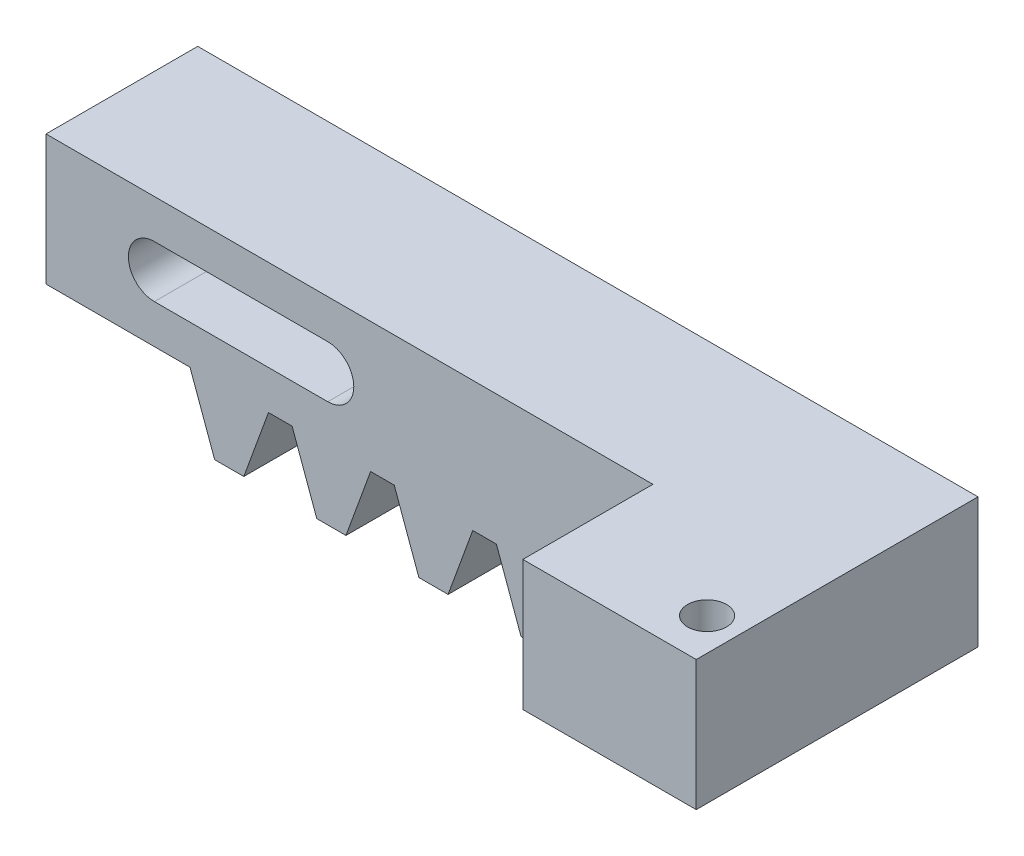
from build123d import *

# Parameters (mm, degrees)
BOSS_EXTRUDE1_START     = 13.5
BOSS_EXTRUDE1_DEPTH     = 7
BOSS_EXTRUDE2_START     = 20.5
SKETCH2_W               = 8
SKETCH2_H               = 6
BOSS_EXTRUDE2_DEPTH     = 6
CUT_EXTRUDE1_DEPTH      = 39.389329572
CUT_EXTRUDE1_DEPTH_BACK = 39.389329572
SKETCH3_R               = 0.9
CUT_EXTRUDE2_DEPTH      = 39.389329572
CUT_EXTRUDE2_DEPTH_BACK = 39.389329572
SKETCH4_W               = 8
SKETCH4_H               = 2.4
CUT_EXTRUDE3_DEPTH      = 39.389329572
CUT_EXTRUDE3_DEPTH_BACK = 39.389329572
SKETCH5_R               = 1.2


with BuildPart() as part:
    # Sketch1 → Boss-Extrude1 (new body)
    with BuildSketch(Plane.XY.offset(BOSS_EXTRUDE1_START)):
        Polygon((-16.7, 19.975), (19.3, 19.975), (19.3, 13.975), (17.125805621, 13.975), (15.988398639, 10.85), (14.642129734, 10.85), (13.504722752, 13.975), (12.41341664, 13.975), (11.276009658, 10.85), (9.929740754, 10.85), (8.792333772, 13.975), (7.70102766, 13.975), (6.563620678, 10.85), (5.217351773, 10.85), (4.079944791, 13.975), (2.988638679, 13.975), (1.851231697, 10.85), (0.504962793, 10.85), (-0.632444189, 13.975), (-1.723750301, 13.975), (-2.861157283, 10.85), (-4.207426188, 10.85), (-5.34483317, 13.975), (-6.436139281, 13.975), (-7.573546263, 10.85), (-8.919815168, 10.85), (-10.05722215, 13.975), (-16.7, 13.975), align=None)
    extrude(amount=BOSS_EXTRUDE1_DEPTH)

    # Sketch2 → Boss-Extrude2 (add)
    with BuildSketch(Plane.XY.offset(BOSS_EXTRUDE2_START)):
        with Locations((15.3, 16.975)):
            Rectangle(SKETCH2_W, SKETCH2_H)
    extrude(amount=BOSS_EXTRUDE2_DEPTH)

    # Sketch3 → Cut-Extrude1 (cut, two sides: drawn at the far end of the back side and taken through both)
    with BuildSketch(Plane(origin=(0, 0, 0), x_dir=(1, 0, 0), z_dir=(0, 1, 0)).offset(-CUT_EXTRUDE1_DEPTH_BACK)):
        with Locations((17.8, -24.5)):
            Circle(SKETCH3_R)
    extrude(amount=CUT_EXTRUDE1_DEPTH + CUT_EXTRUDE1_DEPTH_BACK, mode=Mode.SUBTRACT)

    # Sketch4 → Cut-Extrude2 (cut, two sides: drawn at the far end of the back side and taken through both)
    with BuildSketch(Plane.XY.offset(-CUT_EXTRUDE2_DEPTH_BACK)):
        with Locations((-7.7, 16.975)):
            Rectangle(SKETCH4_W, SKETCH4_H)
    extrude(amount=CUT_EXTRUDE2_DEPTH + CUT_EXTRUDE2_DEPTH_BACK, mode=Mode.SUBTRACT)

    # Sketch5 → Cut-Extrude3 (cut, two sides: drawn at the far end of the back side and taken through both)
    with BuildSketch(Plane.XY.offset(-CUT_EXTRUDE3_DEPTH_BACK)):
        with Locations((-11.7, 16.975)):
            Circle(SKETCH5_R)
        with Locations((-3.7, 16.975)):
            Circle(SKETCH5_R)
    extrude(amount=CUT_EXTRUDE3_DEPTH + CUT_EXTRUDE3_DEPTH_BACK, mode=Mode.SUBTRACT)


solid = part.part
